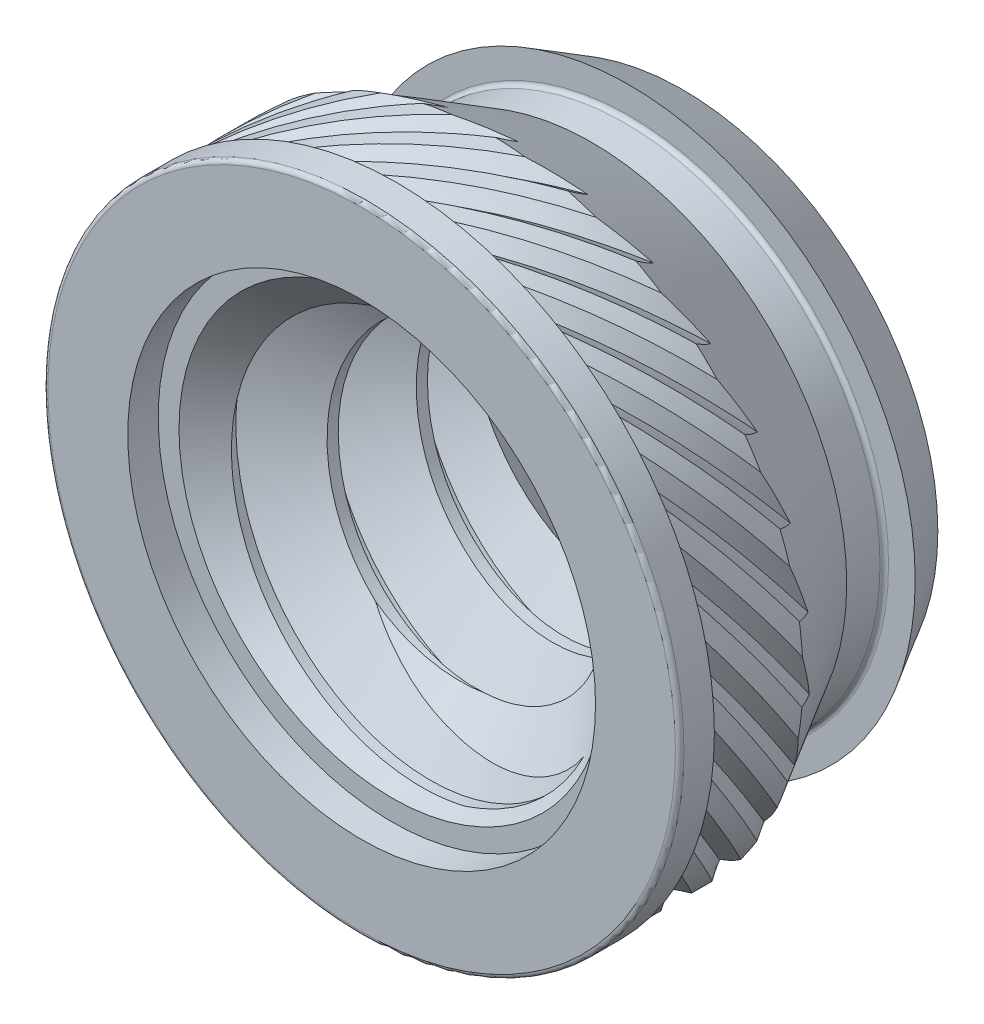
from build123d import *

# Parameters (mm, degrees)
SWEEP1_PITCH                 = 1.058333
SKETCH5_R                    = 2.527568
CUT_EXTRUDE1_OTHER_WAY_DEPTH = 11.67595
CUT_EXTRUDE2_START           = -3.448908
SKETCH5_2_R                  = 2.527568
CUT_EXTRUDE2_DEPTH           = 15.124858
CUT_EXTRUDE2_TAPER           = 45
CUT_EXTRUDE2_OTHER_WAY_DEPTH = 11.67595
CUT_SWEEP1_PITCH             = 16.328571
CUT_SWEEP1_HEIGHT            = 1.496786
CUT_SWEEP1_RADIUS            = 3.7338
CUT_SWEEP1_START_ANGLE       = 90
CIRPATTERN1_COUNT            = 27


with BuildPart() as part:
    # Sketch2 → Revolve1 (revolve)
    with BuildSketch(Plane(origin=(0, 0, 0), x_dir=(0, 0, -1), z_dir=(1, 0, 0)), mode=Mode.PRIVATE) as revolve1_sk:
        with BuildLine():
            Line((-1.905, 2.774092), (-1.543908, 2.774092))
            Line((-1.543908, 2.774092), (-1.543908, 2.413))
            Line((-1.543908, 2.413), (1.905, 2.413))
            Line((1.905, 2.413), (1.905, 3.024283))
            Line((1.905, 3.024283), (1.27, 3.3909))
            Line((1.27, 3.3909), (1.27, 3.075116))
            ThreePointArc((1.27, 3.075116), (1.255121, 3.039195), (1.2192, 3.024316))
            Line((1.2192, 3.024316), (0.824325, 3.024316))
            Line((0.824325, 3.024316), (-0.404537, 3.7338))
            Line((-0.404537, 3.7338), (-1.493108, 3.7338))
            Line((-1.493108, 3.7338), (-1.493108, 3.7719))
            Line((-1.493108, 3.7719), (-1.8542, 3.7719))
            ThreePointArc((-1.8542, 3.7719), (-1.890121, 3.757021), (-1.905, 3.7211))
            Line((-1.905, 3.7211), (-1.905, 2.774092))
        make_face()
    revolve(revolve1_sk.sketch.rotate(Axis((0, 0, 1.905), (0, 0, -1)), 90), axis=Axis((0, 0, 1.905), (0, 0, -1)))

    # Sweep1: the profile of Sketch4 screwed along a right-hand helix of 9.048 turns, 8 arcs to a turn; built about Z, then put on its axis
    sweep1_z = Axis((0, 0, 0), (0, 0, 1))
    sweep1_corners = [(1.725592, 0, -0.529167), (1.725592, 0, -0.396875), (2.470284, 0, 0.033073), (2.470284, 0, -0.959115)]
    with BuildLine(mode=Mode.PRIVATE) as sweep1_profile:
        Line(sweep1_corners[0], sweep1_corners[1])
        Line(sweep1_corners[1], sweep1_corners[2])
        Line(sweep1_corners[2], sweep1_corners[3])
        Line(sweep1_corners[3], sweep1_corners[0])
    sweep1_cap = Face(sweep1_profile.wire())
    sweep1_turn_angles = [0, 22.5, 45, 67.5, 90, 112.5, 135, 157.5, 180, 202.5, 225, 247.5, 270, 292.5, 315, 337.5, 360]
    sweep1_turn_weights = [1, 0.9238795325112867, 1, 0.9238795325112867, 1, 0.9238795325112867, 1, 0.9238795325112867, 1, 0.9238795325112867, 1, 0.9238795325112867, 1, 0.9238795325112867, 1, 0.9238795325112867, 1]
    sweep1_turn_rails = [Edge.make_bspline([Vector(p[0], p[1], 0).rotate(sweep1_z, sweep1_turn_angles[k]) / sweep1_turn_weights[k] + Vector(0, 0, p[2] + SWEEP1_PITCH * sweep1_turn_angles[k] / 360) for k in range(17)], [0, 0, 0, 1, 1, 2, 2, 3, 3, 4, 4, 5, 5, 6, 6, 7, 7, 8, 8, 8], 2, sweep1_turn_weights) for p in sweep1_corners]
    sweep1_turn_sides = [Face.make_surface_from_curves(sweep1_turn_rails[p[0]], sweep1_turn_rails[p[1]]) for p in [(0, 1), (1, 2), (2, 3), (3, 0)]]
    sweep1_last_angles = [3240, 3248.64, 3257.28]
    sweep1_last_weights = [1, 0.9886517447379364, 1]
    sweep1_last_rails = [Edge.make_bspline([Vector(p[0], p[1], 0).rotate(sweep1_z, sweep1_last_angles[k]) / sweep1_last_weights[k] + Vector(0, 0, p[2] + SWEEP1_PITCH * sweep1_last_angles[k] / 360) for k in range(3)], [0, 0, 0, 1, 1, 1], 2, sweep1_last_weights) for p in sweep1_corners]
    sweep1_last_sides = [Face.make_surface_from_curves(sweep1_last_rails[p[0]], sweep1_last_rails[p[1]]) for p in [(0, 1), (1, 2), (2, 3), (3, 0)]]
    sweep1 = Plane(origin=(0, 0, 1.905), x_dir=(0, 1, 0), z_dir=(0, 0, -1)) * Solid(Shell([*[p.moved(Location((0, 0, SWEEP1_PITCH * i))) for i in range(9) for p in sweep1_turn_sides], *sweep1_last_sides, sweep1_cap, sweep1_cap.rotate(sweep1_z, 3257.28).moved(Location((0, 0, SWEEP1_PITCH * 3257.28 / 360)))]))
    add(sweep1)

    # Cut-Extrude1 cone 1 section (through the dimple's axis) → Cut-Extrude1 (revolve, cut)
    with BuildSketch(Plane(origin=(0, 0, 1.543908), x_dir=(0, -1, 0), z_dir=(1, 0, 0))):
        Polygon((0, 0), (2.527568, 0), (0, 2.527568), align=None)
    revolve(axis=Axis((0, 0, 1.543908), (0, 0, -1)), mode=Mode.SUBTRACT)

    # Sketch5 → Cut-Extrude1 other way (cut)
    with BuildSketch(Plane.XY.offset(1.543908)):
        Circle(SKETCH5_R)
    extrude(amount=CUT_EXTRUDE1_OTHER_WAY_DEPTH, mode=Mode.SUBTRACT)

    # Sketch5<2> → Cut-Extrude2 (cut)
    with BuildSketch(Plane.XY.offset(1.543908).offset(CUT_EXTRUDE2_START)):
        Circle(SKETCH5_2_R)
    extrude(amount=CUT_EXTRUDE2_DEPTH, taper=CUT_EXTRUDE2_TAPER, mode=Mode.SUBTRACT)

    # Sketch5<2> → Cut-Extrude2 other way (cut)
    with BuildSketch(Plane.XY.offset(1.543908).offset(CUT_EXTRUDE2_START)):
        Circle(SKETCH5_2_R)
    extrude(amount=-CUT_EXTRUDE2_OTHER_WAY_DEPTH, mode=Mode.SUBTRACT)

    # Cut-Sweep1: sweep along a helix
    with BuildLine() as cut_sweep1_path:
        add(Helix(CUT_SWEEP1_PITCH, CUT_SWEEP1_HEIGHT, CUT_SWEEP1_RADIUS, center=(0, 0, 1.493108), direction=(0, 0, -1), mode=Mode.PRIVATE).rotate(Axis((0, 0, 1.493108), (0, 0, -1)), CUT_SWEEP1_START_ANGLE))
    with BuildLine() as cut_sweep1_axis:
        Line((0, 0, 1.493108), (0, 0, -0.003678))
    # Sketch8 → Cut-Sweep1 (sweep, cut)
    with BuildSketch(Plane.XY.offset(1.493108)):
        with BuildLine():
            Line((-0.260457, 3.724705), (0, 3.6068))
            Line((0, 3.6068), (0.260457, 3.724705))
            ThreePointArc((0.260457, 3.724705), (0, 3.7338), (-0.260457, 3.724705))
        make_face()
    cut_sweep1 = sweep(path=cut_sweep1_path.line, binormal=cut_sweep1_axis.edges()[0], mode=Mode.SUBTRACT)

    # CirPattern1: Cut-Sweep1 ×27 about axis
    cirpattern1_axis = Axis((0, 0, 1.905), (0, 0, -1))
    for i in range(1, CIRPATTERN1_COUNT):
        add(cut_sweep1.rotate(cirpattern1_axis, i * 360 / CIRPATTERN1_COUNT), mode=Mode.SUBTRACT)


solid = part.part
